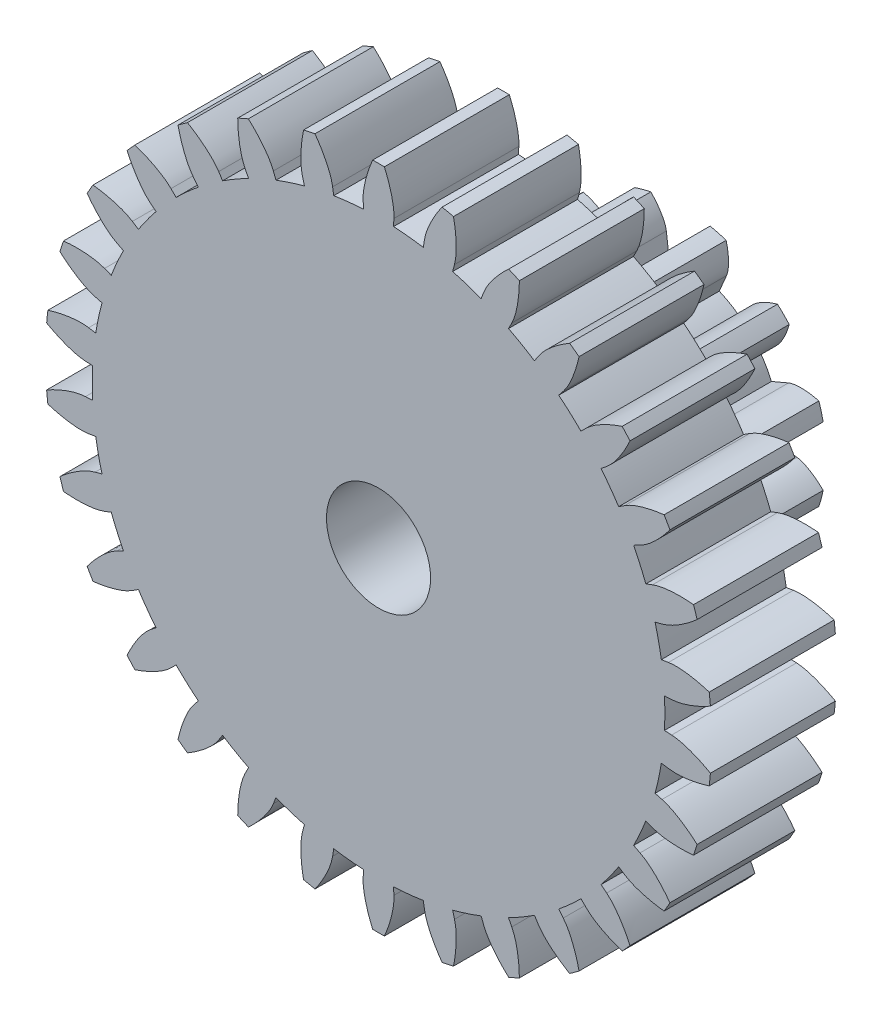
from build123d import *

# Parameters (mm, degrees)
SKETCH_1_R               = 1.4
SKETCH_1_R_2             = 0.5
EXTRUDE_1_DEPTH          = 1.7
CUT_EXTRUDE_1_DEPTH      = 3.60959767
PATTERN_CIRCULAR_1_COUNT = 12
PATTERN_CIRCULAR_1_ANGLE = 330
SKETCH_2_R               = 3.2
SKETCH_2_R_2             = 0.5
EXTRUDE_2_DEPTH          = 1.2
CUT_EXTRUDE_3_DEPTH      = 5.834252954
PATTERN_CIRCULAR_2_COUNT = 30


with BuildPart() as part:
    # 草图1 → 凸台-拉伸1 (new body)
    with BuildSketch(Plane.XY):
        Circle(SKETCH_1_R)
        Circle(SKETCH_1_R_2, mode=Mode.SUBTRACT)
    extrude(amount=EXTRUDE_1_DEPTH)

    # 草图1<3> → 切除-拉伸1 (cut, through all)
    with BuildSketch(Plane.XY):
        with BuildLine():
            Line((1.11946981, 0.135422832), (0.943124287, 0.114090224))
            ThreePointArc((0.943124287, 0.114090224), (0.948279514, 0.057148611), (0.95, 0))
            ThreePointArc((0.95, 0), (0.948279514, -0.057148611), (0.943124287, -0.114090224))
            Line((0.943124287, -0.114090224), (1.11946981, -0.135422832))
            add(Edge.make_bspline(
                [(1.11946981, -0.135422832), (1.128003225, -0.136455124), (1.151602744, -0.141109468), (1.194919759, -0.156967361), (1.260546906, -0.191853213), (1.313246813, -0.231377006), (1.350571488, -0.264875278), (1.370742128, -0.284720947)],
                knots=[0, 0, 0, 0, 0, 0.005604068, 0.015718248, 0.029959916, 0.048452588, 0.048452588, 0.048452588, 0.048452588, 0.048452588], degree=4))
            ThreePointArc((1.370742128, -0.284720947), (1.392666324, -0.143110133), (1.4, 0))
            ThreePointArc((1.4, 0), (1.392666324, 0.143110133), (1.370742128, 0.284720947))
            add(Edge.make_bspline(
                [(1.11946981, 0.135422832), (1.128003225, 0.136455124), (1.151602744, 0.141109468), (1.194919759, 0.156967361), (1.260546906, 0.191853213), (1.313246813, 0.231377006), (1.350571488, 0.264875278), (1.370742128, 0.284720947)],
                knots=[0, 0, 0, 0, 0, 0.005604068, 0.015718248, 0.029959916, 0.048452588, 0.048452588, 0.048452588, 0.048452588, 0.048452588], degree=4))
        make_face()
    cut_extrude_1 = extrude(amount=CUT_EXTRUDE_1_DEPTH, mode=Mode.SUBTRACT)

    # 阵列(圆周)1: 切除-拉伸1 ×12 about axis
    pattern_circular_1_axis = Axis((0, 0, 1.7), (0, 0, 1))
    for i in range(1, PATTERN_CIRCULAR_1_COUNT):
        add(cut_extrude_1.rotate(pattern_circular_1_axis, i * PATTERN_CIRCULAR_1_ANGLE / (PATTERN_CIRCULAR_1_COUNT - 1)), mode=Mode.SUBTRACT)

    # 草图2 → 凸台-拉伸2 (add)
    with BuildSketch(Plane.XY.offset(1.7)):
        Circle(SKETCH_2_R)
        Circle(SKETCH_2_R_2, mode=Mode.SUBTRACT)
    extrude(amount=EXTRUDE_2_DEPTH)

    # 草图2<3> → 切除-拉伸3 (cut, through all)
    with BuildSketch(Plane.XY.offset(1.7)):
        with BuildLine():
            Line((2.815214414, 0.147539136), (2.746231221, 0.14392388))
            ThreePointArc((2.746231221, 0.14392388), (2.749057644, 0.071986608), (2.75, 0))
            ThreePointArc((2.75, 0), (2.749057644, -0.071986608), (2.746231221, -0.14392388))
            Line((2.746231221, -0.14392388), (2.815214414, -0.147539136))
            add(Edge.make_bspline(
                [(2.815214414, -0.147539136), (2.836674033, -0.148663787), (2.896326911, -0.156262405), (2.992499881, -0.18422024), (3.08425284, -0.223276966), (3.153552433, -0.259315751), (3.187838391, -0.278722786)],
                knots=[0, 0, 0, 0, 0, 0.005604068, 0.015718248, 0.026019312, 0.026019312, 0.026019312, 0.026019312, 0.026019312], degree=4))
            ThreePointArc((3.187838391, -0.278722786), (3.196958152, -0.139493993), (3.2, 0))
            ThreePointArc((3.2, 0), (3.196958152, 0.139493993), (3.187838391, 0.278722786))
            add(Edge.make_bspline(
                [(2.815214414, 0.147539136), (2.836674033, 0.148663787), (2.896326911, 0.156262405), (2.992499881, 0.18422024), (3.08425284, 0.223276966), (3.153552433, 0.259315751), (3.187838391, 0.278722786)],
                knots=[0, 0, 0, 0, 0, 0.005604068, 0.015718248, 0.026019312, 0.026019312, 0.026019312, 0.026019312, 0.026019312], degree=4))
        make_face()
    cut_extrude_3 = extrude(amount=CUT_EXTRUDE_3_DEPTH, mode=Mode.SUBTRACT)

    # 阵列(圆周)2: 切除-拉伸3 ×30 about axis
    pattern_circular_2_axis = Axis((0, 0, 2.9), (0, 0, 1))
    for i in range(1, PATTERN_CIRCULAR_2_COUNT):
        add(cut_extrude_3.rotate(pattern_circular_2_axis, i * 360 / PATTERN_CIRCULAR_2_COUNT), mode=Mode.SUBTRACT)


solid = part.part
